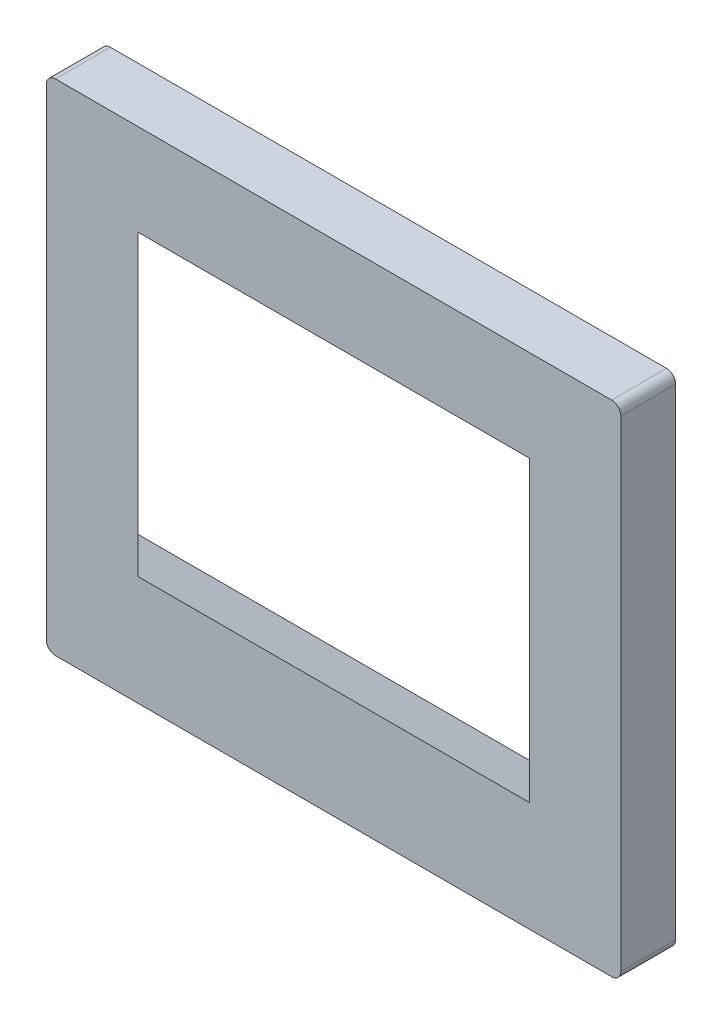
from build123d import *

# Parameters (mm, degrees)
SKETCH1_W           = 62.8
SKETCH1_H           = 54.6
SKETCH1_W_2         = 42.8
SKETCH1_H_2         = 32.6
BOSS_EXTRUDE1_DEPTH = 6
FILLET1_R           = 1


with BuildPart() as part:
    # Sketch1 → Boss-Extrude1 (new body)
    with BuildSketch(Plane.XY):
        with Locations((0, 1.36)):
            Rectangle(SKETCH1_W, SKETCH1_H)
        with Locations((0, 2.36)):
            Rectangle(SKETCH1_W_2, SKETCH1_H_2, mode=Mode.SUBTRACT)
    extrude(amount=-BOSS_EXTRUDE1_DEPTH)

    # Cut-Loft3: read off the stored shape, not the designer's step
    # Cut-Loft3: loft between two sections, ruled curve by curve
    cut_loft3_from = [
        Edge.make_line((-27.4, -15.94, -6), (-27.4, 20.66, -6)),
        Edge.make_line((-27.4, 20.66, -6), (27.4, 20.66, -6)),
        Edge.make_line((27.4, -15.94, -6), (-27.4, -15.94, -6)),
        Edge.make_line((27.4, 20.66, -6), (27.4, -15.94, -6)),
    ]
    cut_loft3_to = [
        Edge.make_line((-21.4, -13.94, 0), (-21.4, 18.66, 0)),
        Edge.make_line((-21.4, 18.66, 0), (21.4, 18.66, 0)),
        Edge.make_line((21.4, -13.94, 0), (-21.4, -13.94, 0)),
        Edge.make_line((21.4, 18.66, 0), (21.4, -13.94, 0)),
    ]
    cut_loft3 = Solid(Shell([*[Face.make_surface_from_curves(cut_loft3_from[k], cut_loft3_to[k]) for k in range(4)], Face(Wire(cut_loft3_from)), Face(Wire(cut_loft3_to))]))
    add(cut_loft3, mode=Mode.SUBTRACT)

    # Fillet1
    fillet1_edges = [part.edges().sort_by_distance(p)[0] for p in [
        (-31.4, -25.94, -3),
        (-31.4, 28.66, -3),
        (31.4, 28.66, -3),
        (31.4, -25.94, -3),
    ]]
    fillet(fillet1_edges, radius=FILLET1_R)


solid = part.part
